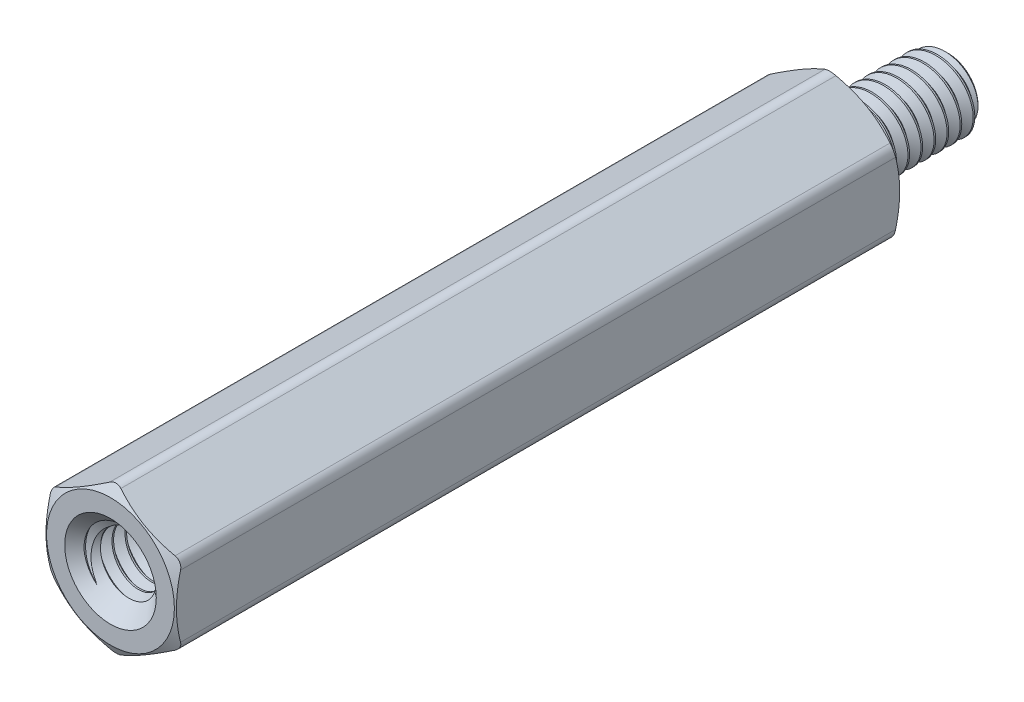
from build123d import *

# Parameters (mm, degrees)
SKETCH4_R           = 1.75
BOSS_EXTRUDE1_DEPTH = 25
SKETCH5_OUTSIDE_W   = 116.724
SKETCH5_OUTSIDE_H   = 117.42
SKETCH5_OUTSIDE_R   = 2.205
CUT_EXTRUDE1_DEPTH  = 30.103650974
CUT_EXTRUDE1_DRAFT  = -60
SKETCH6_OUTSIDE_W   = 103.322
SKETCH6_OUTSIDE_H   = 104.018
SKETCH6_OUTSIDE_R   = 2.205
CUT_EXTRUDE2_DEPTH  = 26.235144145
CUT_EXTRUDE2_DRAFT  = -60
FILLET1_R           = 0.3825
CUT_SWEEP1_PITCH    = 0.45
SKETCH9_R           = 1.475
BOSS_EXTRUDE2_DEPTH = 1.9
SKETCH10_W          = 1.9
SKETCH10_H          = 1.25
CUT_SWEEP2_PITCH    = 0.45


with BuildPart() as part:
    # Sketch3 → Revolve1 (revolve)
    with BuildSketch(Plane(origin=(0, 0, 0), x_dir=(0, 0, -1), z_dir=(1, 0, 0))):
        with BuildLine():
            Line((-23.1, 1.025), (-23.1, 0))
            Line((-23.1, 0), (3.9, 0))
            Line((3.9, 0), (3.9, 1.025))
            Line((3.9, 1.025), (3.675, 1.25))
            Line((3.675, 1.25), (0.63675, 1.25))
            Line((0.63675, 1.25), (0.468, 0.957716426))
            Line((0.468, 0.957716426), (0.225, 0.957716426))
            ThreePointArc((0.225, 0.957716426), (0.065900974, 1.0236174), (0, 1.182716426))
            Line((0, 1.182716426), (0, 2.25))
            Line((0, 2.25), (-25, 2.25))
            Line((-25, 2.25), (-25, 1.475))
            Line((-25, 1.475), (-24.775, 1.25))
            Line((-24.775, 1.25), (-23.325, 1.25))
            Line((-23.325, 1.25), (-23.1, 1.025))
        make_face()
    revolve(axis=Axis((0, 0, -3.9), (0, 0, 1)))

    # Sketch4 → Boss-Extrude1 (add)
    with BuildSketch(Plane.XY.offset(25)):
        Polygon((-2.25, 1.299038106), (-2.25, -1.299038106), (0, -2.598076211), (2.25, -1.299038106), (2.25, 1.299038106), (0, 2.598076211), align=None)
        Circle(SKETCH4_R, mode=Mode.SUBTRACT)
    extrude(amount=-BOSS_EXTRUDE1_DEPTH)


with BuildPart() as cut_extrude1_tool:
    # Sketch5 outside → Cut-Extrude1 (with draft: the straight prism first)
    with BuildSketch(Plane.XY.offset(25)):
        Rectangle(SKETCH5_OUTSIDE_W, SKETCH5_OUTSIDE_H)
        Circle(SKETCH5_OUTSIDE_R, mode=Mode.SUBTRACT)
    extrude(amount=-CUT_EXTRUDE1_DEPTH)
    # Cut-Extrude1: the draft: its side faces are tilted about the plane it starts from
    cut_extrude1_sides = [cut_extrude1_tool.faces().sort_by_distance(p)[0] for p in [
        (0, -58.71, 9.948174513),
        (58.362, 0, 9.948174513),
        (0, 58.71, 9.948174513),
        (-58.362, 0, 9.948174513),
        (-2.205, 0, 9.948174513),
    ]]
    draft(cut_extrude1_sides, Plane.XY.offset(25), CUT_EXTRUDE1_DRAFT)


with BuildPart() as part_1:
    add(part.part)

    # Cut-Extrude1: cut by cut_extrude1_tool
    add(cut_extrude1_tool.part, mode=Mode.SUBTRACT)


with BuildPart() as cut_extrude2_tool:
    # Sketch6 outside → Cut-Extrude2 (with draft: the straight prism first)
    with BuildSketch(Plane(origin=(0, 0, 0), x_dir=(-1, 0, 0), z_dir=(0, 0, -1))):
        Rectangle(SKETCH6_OUTSIDE_W, SKETCH6_OUTSIDE_H)
        Circle(SKETCH6_OUTSIDE_R, mode=Mode.SUBTRACT)
    extrude(amount=-CUT_EXTRUDE2_DEPTH)
    # Cut-Extrude2: the draft: its side faces are tilted about the plane it starts from
    cut_extrude2_sides = [cut_extrude2_tool.faces().sort_by_distance(p)[0] for p in [
        (0, -52.009, 13.117572072),
        (-51.661, 0, 13.117572072),
        (0, 52.009, 13.117572072),
        (51.661, 0, 13.117572072),
        (2.205, 0, 13.117572072),
    ]]
    draft(cut_extrude2_sides, Plane(origin=(0, 0, 0), x_dir=(-1, 0, 0), z_dir=(0, 0, -1)), CUT_EXTRUDE2_DRAFT)


with BuildPart() as part_2:
    add(part_1.part)

    # Cut-Extrude2: cut by cut_extrude2_tool
    add(cut_extrude2_tool.part, mode=Mode.SUBTRACT)

    # Fillet1
    fillet1_edges = [part_2.edges().sort_by_distance(p)[0] for p in [
        (0, 2.598076211, 12.5),
        (-2.25, -1.299038106, 12.5),
        (0, -2.598076211, 12.5),
        (2.25, -1.299038106, 12.5),
        (2.25, 1.299038106, 12.5),
        (-2.25, 1.299038106, 12.5),
    ]]
    fillet(fillet1_edges, radius=FILLET1_R)

    # Cut-Sweep1: the profile of Sketch7 profile screwed along a right-hand helix of 8.406667 turns, 6 arcs to a turn; built about Z, then put on its axis
    cut_sweep1_z = Axis((0, 0, 0), (0, 0, 1))
    cut_sweep1_corners = [(0.957416426, 0, -0.168923205), (0.957416426, 0, -0.224826795), (1.274356964, 0, -0.4078125), (1.274356964, 0, 0.0140625)]
    with BuildLine(mode=Mode.PRIVATE) as cut_sweep1_profile:
        Line(cut_sweep1_corners[0], cut_sweep1_corners[1])
        Line(cut_sweep1_corners[1], cut_sweep1_corners[2])
        Line(cut_sweep1_corners[2], cut_sweep1_corners[3])
        Line(cut_sweep1_corners[3], cut_sweep1_corners[0])
    cut_sweep1_cap = Face(cut_sweep1_profile.wire())
    cut_sweep1_turn_angles = [0, 30, 60, 90, 120, 150, 180, 210, 240, 270, 300, 330, 360]
    cut_sweep1_turn_weights = [1, 0.8660254037844387, 1, 0.8660254037844387, 1, 0.8660254037844387, 1, 0.8660254037844387, 1, 0.8660254037844387, 1, 0.8660254037844387, 1]
    cut_sweep1_turn_rails = [Edge.make_bspline([Vector(p[0], p[1], 0).rotate(cut_sweep1_z, cut_sweep1_turn_angles[k]) / cut_sweep1_turn_weights[k] + Vector(0, 0, p[2] + CUT_SWEEP1_PITCH * cut_sweep1_turn_angles[k] / 360) for k in range(13)], [0, 0, 0, 1, 1, 2, 2, 3, 3, 4, 4, 5, 5, 6, 6, 6], 2, cut_sweep1_turn_weights) for p in cut_sweep1_corners]
    cut_sweep1_turn_sides = [Face.make_surface_from_curves(cut_sweep1_turn_rails[p[0]], cut_sweep1_turn_rails[p[1]]) for p in [(0, 1), (1, 2), (2, 3), (3, 0)]]
    cut_sweep1_last_angles = [2880, 2910, 2940, 2970, 3000, 3013.2, 3026.4]
    cut_sweep1_last_weights = [1, 0.8660254037844387, 1, 0.8660254037844387, 1, 0.9735789028731555, 1]
    cut_sweep1_last_rails = [Edge.make_bspline([Vector(p[0], p[1], 0).rotate(cut_sweep1_z, cut_sweep1_last_angles[k]) / cut_sweep1_last_weights[k] + Vector(0, 0, p[2] + CUT_SWEEP1_PITCH * cut_sweep1_last_angles[k] / 360) for k in range(7)], [0, 0, 0, 1, 1, 2, 2, 3, 3, 3], 2, cut_sweep1_last_weights) for p in cut_sweep1_corners]
    cut_sweep1_last_sides = [Face.make_surface_from_curves(cut_sweep1_last_rails[p[0]], cut_sweep1_last_rails[p[1]]) for p in [(0, 1), (1, 2), (2, 3), (3, 0)]]
    cut_sweep1 = Plane(origin=(0, 0, -3.9), x_dir=(0, 1, 0), z_dir=(0, 0, 1)) * Solid(Shell([*[p.moved(Location((0, 0, CUT_SWEEP1_PITCH * i))) for i in range(8) for p in cut_sweep1_turn_sides], *cut_sweep1_last_sides, cut_sweep1_cap, cut_sweep1_cap.rotate(cut_sweep1_z, 3026.4).moved(Location((0, 0, CUT_SWEEP1_PITCH * 3026.4 / 360)))]))
    add(cut_sweep1, mode=Mode.SUBTRACT)

    # Sketch9 → Boss-Extrude2 (add)
    with BuildSketch(Plane.XY.offset(23.1)):
        Circle(SKETCH9_R)
    extrude(amount=BOSS_EXTRUDE2_DEPTH)


with BuildPart() as body_2:
    # Sketch10 → Revolve2 (revolve)
    with BuildSketch(Plane(origin=(0, 0, 0), x_dir=(0, 0, -1), z_dir=(1, 0, 0))):
        with Locations((-24.05, 0.625)):
            Rectangle(SKETCH10_W, SKETCH10_H)
    revolve(axis=Axis((0, 0, -3.9), (0, 0, 1)))

    # Cut-Sweep2: the profile of Sketch12 profile screwed along a right-hand helix of 5.222222 turns, 6 arcs to a turn; built about Z, then put on its axis
    cut_sweep2_z = Axis((0, 0, 0), (0, 0, 1))
    cut_sweep2_corners = [(0.957416426, 0, -0.224826795), (0.957416426, 0, -0.168923205), (1.274356964, 0, 0.0140625), (1.274356964, 0, -0.4078125)]
    with BuildLine(mode=Mode.PRIVATE) as cut_sweep2_profile:
        Line(cut_sweep2_corners[0], cut_sweep2_corners[1])
        Line(cut_sweep2_corners[1], cut_sweep2_corners[2])
        Line(cut_sweep2_corners[2], cut_sweep2_corners[3])
        Line(cut_sweep2_corners[3], cut_sweep2_corners[0])
    cut_sweep2_cap = Face(cut_sweep2_profile.wire())
    cut_sweep2_turn_angles = [0, 30, 60, 90, 120, 150, 180, 210, 240, 270, 300, 330, 360]
    cut_sweep2_turn_weights = [1, 0.8660254037844387, 1, 0.8660254037844387, 1, 0.8660254037844387, 1, 0.8660254037844387, 1, 0.8660254037844387, 1, 0.8660254037844387, 1]
    cut_sweep2_turn_rails = [Edge.make_bspline([Vector(p[0], p[1], 0).rotate(cut_sweep2_z, cut_sweep2_turn_angles[k]) / cut_sweep2_turn_weights[k] + Vector(0, 0, p[2] + CUT_SWEEP2_PITCH * cut_sweep2_turn_angles[k] / 360) for k in range(13)], [0, 0, 0, 1, 1, 2, 2, 3, 3, 4, 4, 5, 5, 6, 6, 6], 2, cut_sweep2_turn_weights) for p in cut_sweep2_corners]
    cut_sweep2_turn_sides = [Face.make_surface_from_curves(cut_sweep2_turn_rails[p[0]], cut_sweep2_turn_rails[p[1]]) for p in [(0, 1), (1, 2), (2, 3), (3, 0)]]
    cut_sweep2_last_angles = [1800, 1830, 1860, 1870, 1880]
    cut_sweep2_last_weights = [1, 0.8660254037844387, 1, 0.9848077530122036, 1]
    cut_sweep2_last_rails = [Edge.make_bspline([Vector(p[0], p[1], 0).rotate(cut_sweep2_z, cut_sweep2_last_angles[k]) / cut_sweep2_last_weights[k] + Vector(0, 0, p[2] + CUT_SWEEP2_PITCH * cut_sweep2_last_angles[k] / 360) for k in range(5)], [0, 0, 0, 1, 1, 2, 2, 2], 2, cut_sweep2_last_weights) for p in cut_sweep2_corners]
    cut_sweep2_last_sides = [Face.make_surface_from_curves(cut_sweep2_last_rails[p[0]], cut_sweep2_last_rails[p[1]]) for p in [(0, 1), (1, 2), (2, 3), (3, 0)]]
    cut_sweep2 = Plane(origin=(0, 0, 25), x_dir=(0, 1, 0), z_dir=(0, 0, -1)) * Solid(Shell([*[p.moved(Location((0, 0, CUT_SWEEP2_PITCH * i))) for i in range(5) for p in cut_sweep2_turn_sides], *cut_sweep2_last_sides, cut_sweep2_cap, cut_sweep2_cap.rotate(cut_sweep2_z, 1880).moved(Location((0, 0, CUT_SWEEP2_PITCH * 1880 / 360)))]))
    add(cut_sweep2, mode=Mode.SUBTRACT)


with BuildPart() as part_3:
    add(part_2.part)

    # Combine1: cut body 2
    add(body_2.part, mode=Mode.SUBTRACT)

    # Cut-Extrude3 cone 1 section (through the dimple's axis) → Cut-Extrude3 (revolve, cut)
    with BuildSketch(Plane(origin=(0, 0, 25), x_dir=(0, -1, 0), z_dir=(1, 0, 0))):
        Polygon((0, 0), (1.58, 0), (0, 1.58), align=None)
    revolve(axis=Axis((0, 0, 25), (0, 0, -1)), mode=Mode.SUBTRACT)


solid = part_3.part
